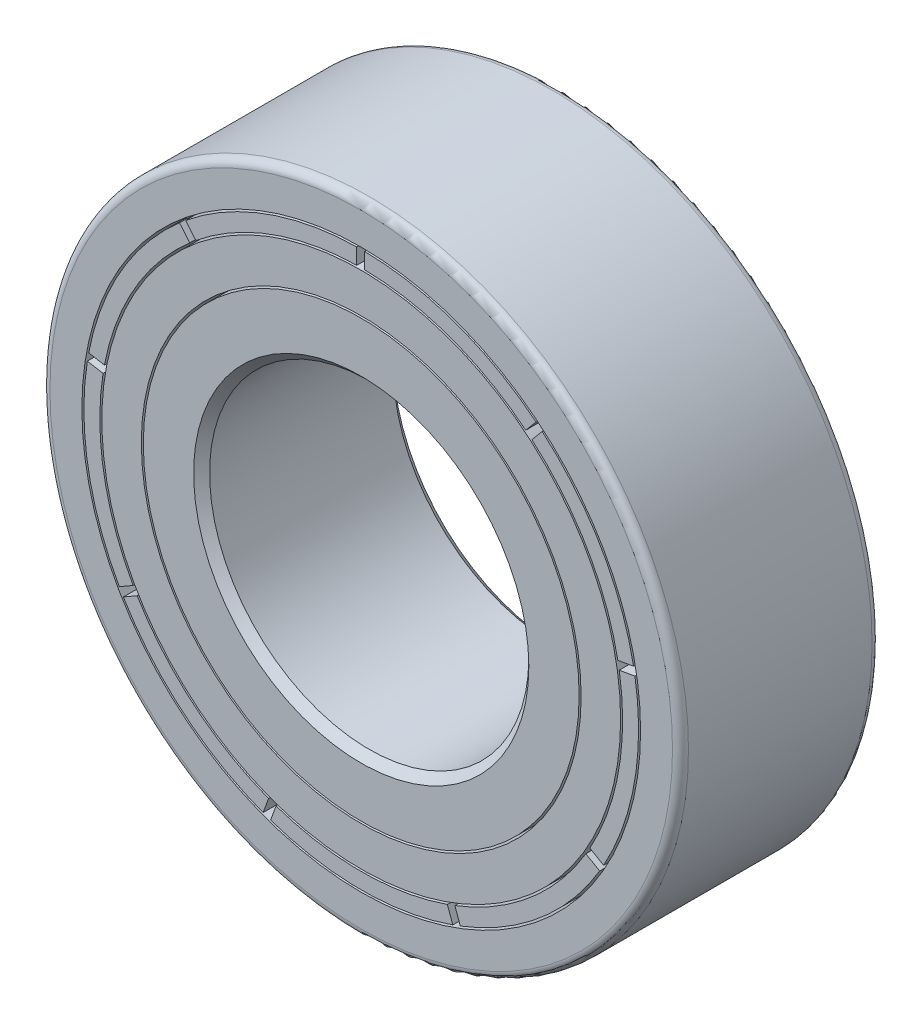
from build123d import *

# Parameters (mm, degrees)
SKETCH1_R                = 8
BOSS_EXTRUDE1_DEPTH      = 5
SKETCH1_3_R              = 4
CUT_EXTRUDE1_DEPTH       = 5
SKETCH1_4_R              = 7
CUT_EXTRUDE2_DEPTH       = 5
SKETCH1_5_R              = 6.5
BOSS_EXTRUDE2_DEPTH      = 5
SKETCH1_6_R              = 4
CUT_EXTRUDE3_DEPTH       = 5
SKETCH3_R                = 7
SKETCH3_R_2              = 6.5
BOSS_EXTRUDE3_DEPTH      = 5
MOVE_START               = -5
MOVE_FACE1_OUTLINE_R     = 7
MOVE_FACE1_OUTLINE_R_2   = 6.95
MOVE_FACE1_OUTLINE_R_3   = 6.55
MOVE_FACE1_OUTLINE_R_4   = 6.5
MOVE_FACE1_DEPTH         = 5
BOSS_EXTRUDE4_DEPTH      = 1
BOSS_EXTRUDE4_DEPTH_BACK = 6
SKETCH4_W                = 0.2
SKETCH4_H                = 2.390737137
CIRPATTERN1_COUNT        = 9
SKETCH5_R                = 5.51056118
SKETCH5_R_2              = 5.46056118
CUT_EXTRUDE4_DEPTH       = 6
FILLET1_R                = 0.2
CHAMFER1_SIZE            = 0.2


# Read off the part's stored shape, not the designer's step: Move Face1
with BuildPart() as part:
    # Sketch1 → Boss-Extrude1 (new body)
    with BuildSketch(Plane.XY):
        Circle(SKETCH1_R)
    extrude(amount=-BOSS_EXTRUDE1_DEPTH)

    # Sketch1<3> → Cut-Extrude1 (cut)
    with BuildSketch(Plane.XY):
        Circle(SKETCH1_3_R)
    extrude(amount=-CUT_EXTRUDE1_DEPTH, mode=Mode.SUBTRACT)

    # Sketch1<4> → Cut-Extrude2 (cut)
    with BuildSketch(Plane.XY):
        Circle(SKETCH1_4_R)
    extrude(amount=-CUT_EXTRUDE2_DEPTH, mode=Mode.SUBTRACT)

    # Fillet1
    fillet1_edges = [part.edges().sort_by_distance(p)[0] for p in [
        (-8, 0, 0),
        (-8, 0, -5),
    ]]
    fillet(fillet1_edges, radius=FILLET1_R)


with BuildPart() as body_2:
    # Sketch1<5> → Boss-Extrude2 (new body)
    with BuildSketch(Plane.XY):
        Circle(SKETCH1_5_R)
    extrude(amount=-BOSS_EXTRUDE2_DEPTH)

    # Sketch1<6> → Cut-Extrude3 (cut)
    with BuildSketch(Plane.XY):
        Circle(SKETCH1_6_R)
    extrude(amount=-CUT_EXTRUDE3_DEPTH, mode=Mode.SUBTRACT)

    # Sketch5 → Cut-Extrude4 (cut)
    with BuildSketch(Plane.XY):
        Circle(SKETCH5_R)
        Circle(SKETCH5_R_2, mode=Mode.SUBTRACT)
    extrude(amount=-CUT_EXTRUDE4_DEPTH, mode=Mode.SUBTRACT)


with BuildPart() as body_3:
    # Sketch3 → Boss-Extrude3 (new body)
    with BuildSketch(Plane.XY):
        Circle(SKETCH3_R)
        Circle(SKETCH3_R_2, mode=Mode.SUBTRACT)
    extrude(amount=-BOSS_EXTRUDE3_DEPTH)

    # Move Face1 outline → Move Face1 (cut)
    # profile 1 of 2: a face of its own
    with BuildSketch(Plane.XY.offset(MOVE_START)):
        Circle(MOVE_FACE1_OUTLINE_R)
        Circle(MOVE_FACE1_OUTLINE_R_2, mode=Mode.SUBTRACT)
    # profile 2 of 2: a face of its own
    with BuildSketch(Plane.XY.offset(MOVE_START)):
        Circle(MOVE_FACE1_OUTLINE_R_3)
        Circle(MOVE_FACE1_OUTLINE_R_4, mode=Mode.SUBTRACT)
    extrude(amount=MOVE_FACE1_DEPTH, mode=Mode.SUBTRACT)


with BuildPart() as body_4:
    # Sketch4 → Boss-Extrude4 (new, two sides: drawn at the far end of the back side and taken through both)
    with BuildSketch(Plane(origin=(0, 0, -5), x_dir=(-1, 0, 0), z_dir=(0, 0, -1)).offset(-BOSS_EXTRUDE4_DEPTH_BACK)):
        with Locations((0.01287322, 6.333584267)):
            Rectangle(SKETCH4_W, SKETCH4_H)
    extrude(amount=BOSS_EXTRUDE4_DEPTH + BOSS_EXTRUDE4_DEPTH_BACK)


with BuildPart() as cirpattern1_1:
    # CirPattern1: pattern copy
    add(body_4.part.rotate(Axis((0, 0, 0), (0, 0, 1)), 1 * 360 / CIRPATTERN1_COUNT))


with BuildPart() as cirpattern1_2:
    # CirPattern1: pattern copy
    add(body_4.part.rotate(Axis((0, 0, 0), (0, 0, 1)), 2 * 360 / CIRPATTERN1_COUNT))


with BuildPart() as cirpattern1_3:
    # CirPattern1: pattern copy
    add(body_4.part.rotate(Axis((0, 0, 0), (0, 0, 1)), 3 * 360 / CIRPATTERN1_COUNT))


with BuildPart() as cirpattern1_4:
    # CirPattern1: pattern copy
    add(body_4.part.rotate(Axis((0, 0, 0), (0, 0, 1)), 4 * 360 / CIRPATTERN1_COUNT))


with BuildPart() as cirpattern1_5:
    # CirPattern1: pattern copy
    add(body_4.part.rotate(Axis((0, 0, 0), (0, 0, 1)), 5 * 360 / CIRPATTERN1_COUNT))


with BuildPart() as cirpattern1_6:
    # CirPattern1: pattern copy
    add(body_4.part.rotate(Axis((0, 0, 0), (0, 0, 1)), 6 * 360 / CIRPATTERN1_COUNT))


with BuildPart() as cirpattern1_7:
    # CirPattern1: pattern copy
    add(body_4.part.rotate(Axis((0, 0, 0), (0, 0, 1)), 7 * 360 / CIRPATTERN1_COUNT))


with BuildPart() as cirpattern1_8:
    # CirPattern1: pattern copy
    add(body_4.part.rotate(Axis((0, 0, 0), (0, 0, 1)), 8 * 360 / CIRPATTERN1_COUNT))


with BuildPart() as body_3_1:
    add(body_3.part)

    # Combine1: cut body 4, CirPattern1_1, CirPattern1_2, CirPattern1_3, CirPattern1_4, CirPattern1_5, CirPattern1_6, CirPattern1_7, CirPattern1_8
    add(body_4.part, mode=Mode.SUBTRACT)
    add(cirpattern1_1.part, mode=Mode.SUBTRACT)
    add(cirpattern1_2.part, mode=Mode.SUBTRACT)
    add(cirpattern1_3.part, mode=Mode.SUBTRACT)
    add(cirpattern1_4.part, mode=Mode.SUBTRACT)
    add(cirpattern1_5.part, mode=Mode.SUBTRACT)
    add(cirpattern1_6.part, mode=Mode.SUBTRACT)
    add(cirpattern1_7.part, mode=Mode.SUBTRACT)
    add(cirpattern1_8.part, mode=Mode.SUBTRACT)


with BuildPart() as cut_extrude4_piece_1:
    # of the separate pieces the step leaves, piece 1, a body of its own (cut_extrude4_pieces)
    add(body_2.part.solids().sort_by_distance((5.46056118, 0, 0))[0])

    # Chamfer1
    chamfer1_edges = [cut_extrude4_piece_1.edges().sort_by_distance(p)[0] for p in [
        (-4, 0, -5),
        (-4, 0, 0),
    ]]
    chamfer(chamfer1_edges, length=CHAMFER1_SIZE)


with BuildPart() as cut_extrude4_piece_2:
    # of the separate pieces the step leaves, piece 2, a body of its own (cut_extrude4_pieces)
    add(body_2.part.solids().sort_by_distance((6.5, 0, 0))[0])


solid = Compound([part.part, body_3_1.part, cut_extrude4_piece_1.part, cut_extrude4_piece_2.part])
